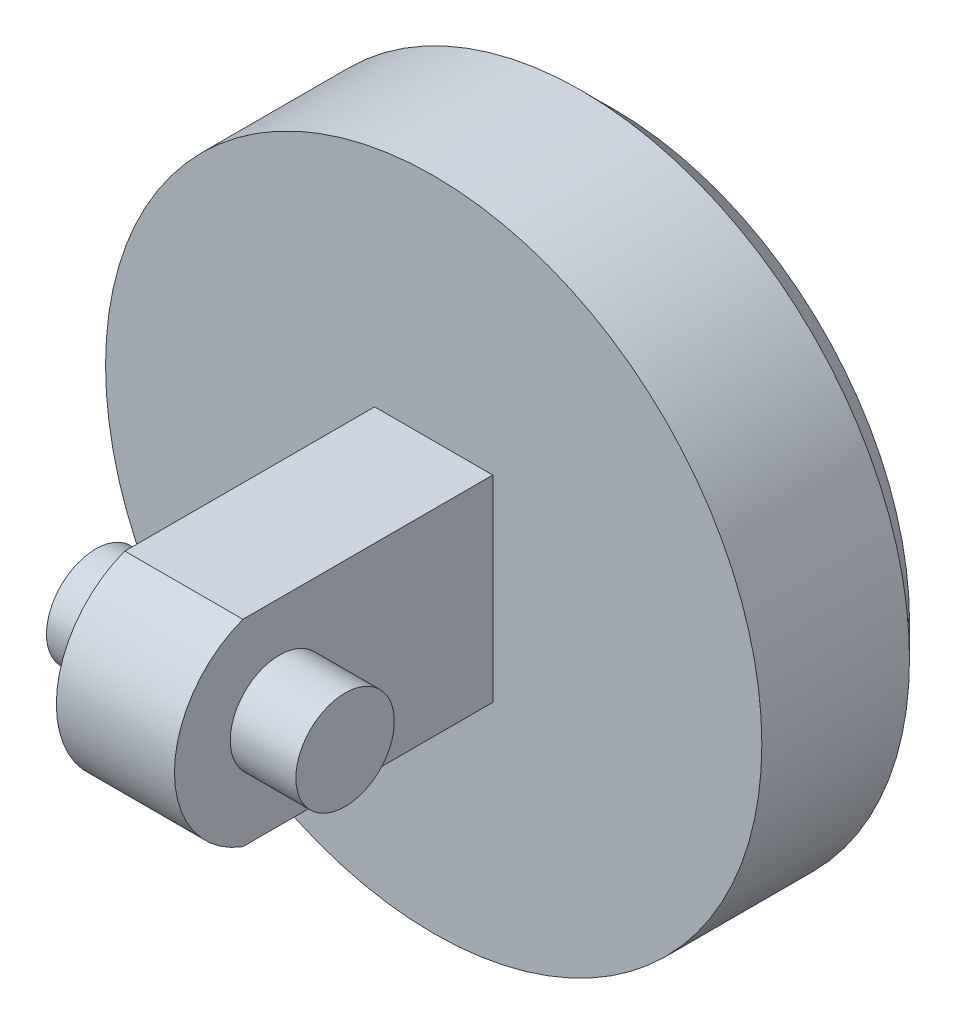
from build123d import *

# Parameters (mm, degrees)
SKETCH_1_R          = 10
EXTRUDE_1_DEPTH     = 5.5
SKETCH_2_W          = 3.6
SKETCH_2_H          = 6
EXTRUDE_2_DEPTH     = 9.7
CUT_EXTRUDE_START   = -3.6
CUT_EXTRUDE_1_DEPTH = 3.6
CHAMFER_1_SIZE      = 1
SKETCH_4_R          = 1.5
EXTRUDE_3_DEPTH     = 2


# Read off the part's stored shape, not the designer's step: 切除-拉伸1
with BuildPart() as part:
    # 草图1 → 凸台-拉伸1 (new body)
    with BuildSketch(Plane.XY):
        Circle(SKETCH_1_R)
    extrude(amount=EXTRUDE_1_DEPTH)

    # 草图2 → 凸台-拉伸2 (add)
    with BuildSketch(Plane.XY.offset(5.5)):
        Rectangle(SKETCH_2_W, SKETCH_2_H)
    extrude(amount=EXTRUDE_2_DEPTH)

    # 切除-拉伸1 outline → 切除-拉伸1 (cut)
    with BuildSketch(Plane.ZY.offset(1.8).offset(CUT_EXTRUDE_START)):
        with BuildLine():
            Line((15.2, 3), (13.113552873, 3))
            ThreePointArc((13.113552873, 3), (14.627105745, 1.827105745), (15.2, 0))
            Line((15.2, 0), (15.2, 3))
        make_face()
        with BuildLine():
            Line((15.2, -3), (15.2, 0))
            ThreePointArc((15.2, 0), (14.627105745, -1.827105745), (13.113552873, -3))
            Line((13.113552873, -3), (15.2, -3))
        make_face()
    extrude(amount=CUT_EXTRUDE_1_DEPTH, mode=Mode.SUBTRACT)

    # 倒角1
    chamfer_1_edges = [part.edges().sort_by_distance(p)[0] for p in [
        (-10, 0, 0),
    ]]
    chamfer(chamfer_1_edges, length=CHAMFER_1_SIZE)

    # 草图4 → 凸台-拉伸3 (add)
    with BuildSketch(Plane.ZY.offset(1.8)):
        with Locations(Location((12, 0, 0), (0, 0, 180))):
            Circle(SKETCH_4_R)
    extrude_3 = extrude(amount=EXTRUDE_3_DEPTH)

    # 镜向1: 凸台-拉伸3 across plane
    add(extrude_3.mirror(Plane(origin=(0, 0, 0), x_dir=(0, 0, 1), z_dir=(1, 0, 0))))


solid = part.part
